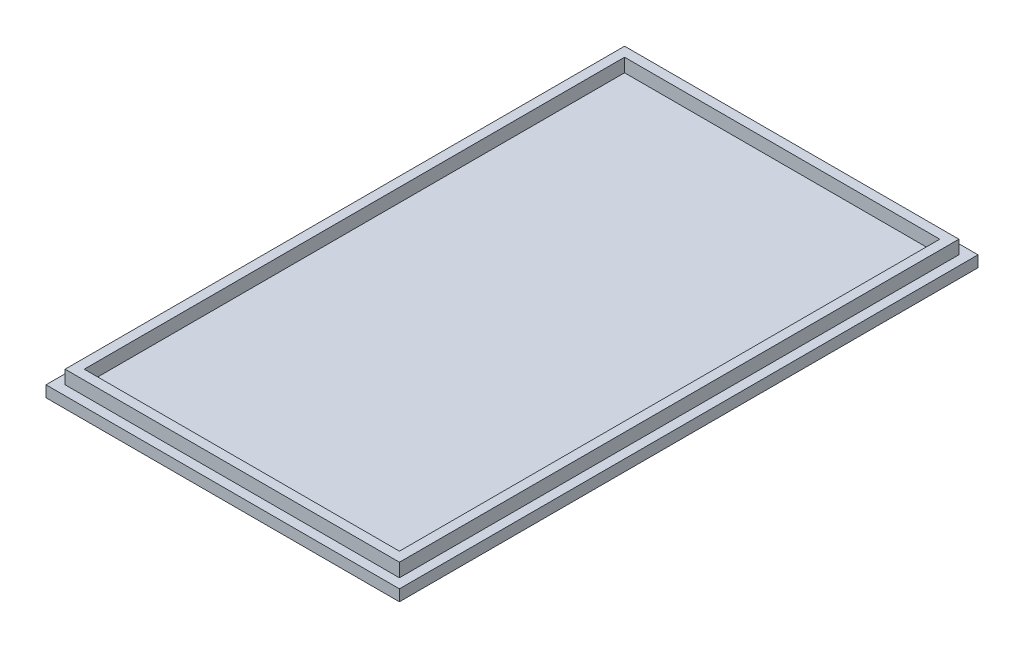
from build123d import *

# Parameters (mm, degrees)
SKETCH1_W           = 47.09116882
SKETCH1_H           = 77.09116882
BOSS_EXTRUDE1_DEPTH = 1.5
SKETCH2_W           = 44.545584412
SKETCH2_H           = 74.545584412
SKETCH2_W_2         = 42
SKETCH2_H_2         = 72
BOSS_EXTRUDE2_DEPTH = 1.8


with BuildPart() as part:
    # Sketch1 → Boss-Extrude1 (new body)
    with BuildSketch(Plane(origin=(0, 0, 0), x_dir=(1, 0, 0), z_dir=(0, 1, 0))):
        with Locations((23.54558441, -38.54558441)):
            Rectangle(SKETCH1_W, SKETCH1_H)
    extrude(amount=BOSS_EXTRUDE1_DEPTH)

    # Sketch2 → Boss-Extrude2 (add)
    with BuildSketch(Plane(origin=(0, 1.5, 0), x_dir=(1, 0, 0), z_dir=(0, 1, 0))):
        with Locations((23.545584412, -38.545584412)):
            Rectangle(SKETCH2_W, SKETCH2_H)
        with Locations((23.545584412, -38.545584412)):
            Rectangle(SKETCH2_W_2, SKETCH2_H_2, mode=Mode.SUBTRACT)
    extrude(amount=BOSS_EXTRUDE2_DEPTH)


solid = part.part
